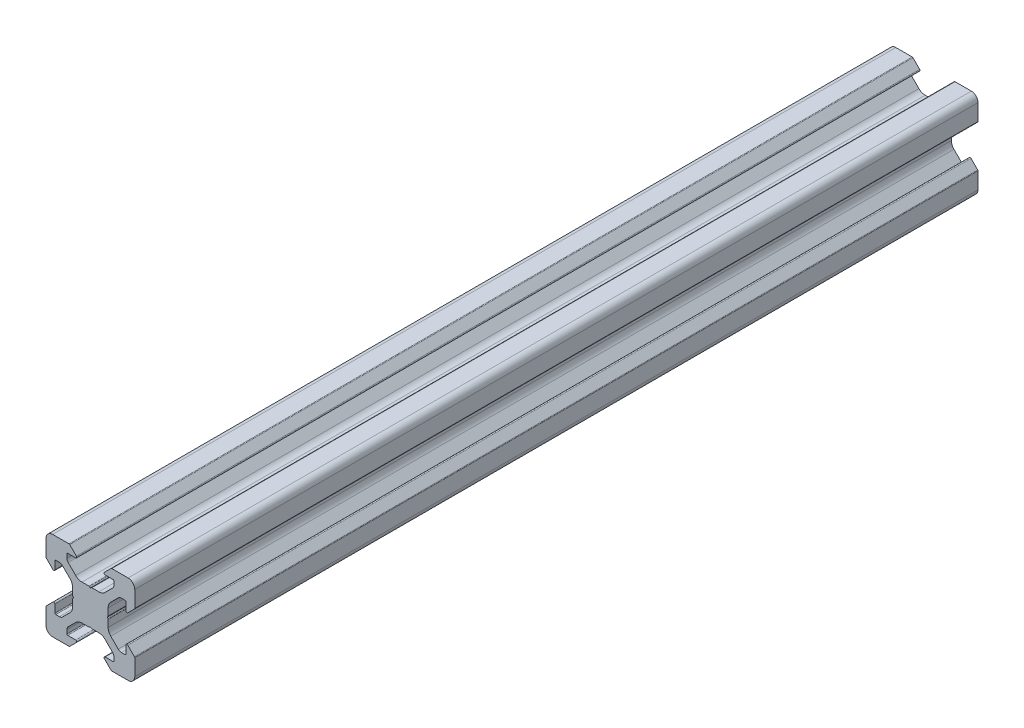
from build123d import *

# Parameters (mm, degrees)
EXTRUDE_1_DEPTH = 190


# Read off the part's stored shape, not the designer's step: 222 Конструкционный профиль 20х20-1-surface1
with BuildPart() as part:
    # Эскиз1 → Бобышка-Вытянуть1 (new body)
    with BuildSketch(Plane.XY):
        with BuildLine():
            Line((-3.945217202, 0.181521503), (-3.8, 0))
            Line((-3.8, 0), (-3.945217202, -0.181521503))
            ThreePointArc((-3.945217202, -0.181521503), (-3.98590708, -0.254943529), (-4, -0.337695265))
            Line((-4, -0.337695265), (-4, -1.898780669))
            ThreePointArc((-4, -1.898780669), (-4.152240935, -2.664147534), (-4.585786438, -3.312994231))
            Line((-4.585786438, -3.312994231), (-6.279898987, -5.007106781))
            ThreePointArc((-6.279898987, -5.007106781), (-6.604322336, -5.223879533), (-6.987005769, -5.3))
            Line((-6.987005769, -5.3), (-7.8, -5.3))
            ThreePointArc((-7.8, -5.3), (-7.941421356, -5.241421356), (-8, -5.1))
            Line((-8, -5.1), (-8, -3.33))
            ThreePointArc((-8, -3.33), (-8.154329142, -3.099030117), (-8.426776695, -3.153223305))
            Line((-8.426776695, -3.153223305), (-9.926776695, -4.653223305))
            ThreePointArc((-9.926776695, -4.653223305), (-9.980969883, -4.734329142), (-10, -4.83))
            Line((-10, -4.83), (-10, -8.5))
            ThreePointArc((-10, -8.5), (-9.560660172, -9.560660172), (-8.5, -10))
            Line((-8.5, -10), (-4.83, -10))
            ThreePointArc((-4.83, -10), (-4.734329142, -9.980969883), (-4.653223305, -9.926776695))
            Line((-4.653223305, -9.926776695), (-3.153223305, -8.426776695))
            ThreePointArc((-3.153223305, -8.426776695), (-3.099030117, -8.154329142), (-3.33, -8))
            Line((-3.33, -8), (-5.1, -8))
            ThreePointArc((-5.1, -8), (-5.241421356, -7.941421356), (-5.3, -7.8))
            Line((-5.3, -7.8), (-5.3, -6.987005769))
            ThreePointArc((-5.3, -6.987005769), (-5.223879533, -6.604322336), (-5.007106781, -6.279898987))
            Line((-5.007106781, -6.279898987), (-3.312994231, -4.585786438))
            ThreePointArc((-3.312994231, -4.585786438), (-2.664147534, -4.152240935), (-1.898780669, -4))
            Line((-1.898780669, -4), (-0.337695265, -4))
            ThreePointArc((-0.337695265, -4), (-0.254943529, -3.98590708), (-0.181521503, -3.945217202))
            Line((-0.181521503, -3.945217202), (0, -3.8))
            Line((0, -3.8), (0.181521503, -3.945217202))
            ThreePointArc((0.181521503, -3.945217202), (0.254943529, -3.98590708), (0.337695265, -4))
            Line((0.337695265, -4), (1.898780669, -4))
            ThreePointArc((1.898780669, -4), (2.664147534, -4.152240935), (3.312994231, -4.585786438))
            Line((3.312994231, -4.585786438), (5.007106781, -6.279898987))
            ThreePointArc((5.007106781, -6.279898987), (5.223879533, -6.604322336), (5.3, -6.987005769))
            Line((5.3, -6.987005769), (5.3, -7.8))
            ThreePointArc((5.3, -7.8), (5.241421356, -7.941421356), (5.1, -8))
            Line((5.1, -8), (3.33, -8))
            ThreePointArc((3.33, -8), (3.099030117, -8.154329142), (3.153223305, -8.426776695))
            Line((3.153223305, -8.426776695), (4.653223305, -9.926776695))
            ThreePointArc((4.653223305, -9.926776695), (4.734329142, -9.980969883), (4.83, -10))
            Line((4.83, -10), (8.5, -10))
            ThreePointArc((8.5, -10), (9.560660172, -9.560660172), (10, -8.5))
            Line((10, -8.5), (10, -4.83))
            ThreePointArc((10, -4.83), (9.980969883, -4.734329142), (9.926776695, -4.653223305))
            Line((9.926776695, -4.653223305), (8.426776695, -3.153223305))
            ThreePointArc((8.426776695, -3.153223305), (8.154329142, -3.099030117), (8, -3.33))
            Line((8, -3.33), (8, -5.1))
            ThreePointArc((8, -5.1), (7.941421356, -5.241421356), (7.8, -5.3))
            Line((7.8, -5.3), (6.987005769, -5.3))
            ThreePointArc((6.987005769, -5.3), (6.604322336, -5.223879533), (6.279898987, -5.007106781))
            Line((6.279898987, -5.007106781), (4.585786438, -3.312994231))
            ThreePointArc((4.585786438, -3.312994231), (4.152240935, -2.664147534), (4, -1.898780669))
            Line((4, -1.898780669), (4, -0.337695265))
            ThreePointArc((4, -0.337695265), (3.98590708, -0.254943529), (3.945217202, -0.181521503))
            Line((3.945217202, -0.181521503), (3.8, 0))
            Line((3.8, 0), (3.945217202, 0.181521503))
            ThreePointArc((3.945217202, 0.181521503), (3.98590708, 0.254943529), (4, 0.337695265))
            Line((4, 0.337695265), (4, 1.898780669))
            ThreePointArc((4, 1.898780669), (4.152240935, 2.664147534), (4.585786438, 3.312994231))
            Line((4.585786438, 3.312994231), (6.279898987, 5.007106781))
            ThreePointArc((6.279898987, 5.007106781), (6.604322336, 5.223879533), (6.987005769, 5.3))
            Line((6.987005769, 5.3), (7.8, 5.3))
            ThreePointArc((7.8, 5.3), (7.941421356, 5.241421356), (8, 5.1))
            Line((8, 5.1), (8, 3.33))
            ThreePointArc((8, 3.33), (8.154329142, 3.099030117), (8.426776695, 3.153223305))
            Line((8.426776695, 3.153223305), (9.926776695, 4.653223305))
            ThreePointArc((9.926776695, 4.653223305), (9.980969883, 4.734329142), (10, 4.83))
            Line((10, 4.83), (10, 8.5))
            ThreePointArc((10, 8.5), (9.560660172, 9.560660172), (8.5, 10))
            Line((8.5, 10), (4.83, 10))
            ThreePointArc((4.83, 10), (4.734329142, 9.980969883), (4.653223305, 9.926776695))
            Line((4.653223305, 9.926776695), (3.153223305, 8.426776695))
            ThreePointArc((3.153223305, 8.426776695), (3.099030117, 8.154329142), (3.33, 8))
            Line((3.33, 8), (5.1, 8))
            ThreePointArc((5.1, 8), (5.241421356, 7.941421356), (5.3, 7.8))
            Line((5.3, 7.8), (5.3, 6.987005769))
            ThreePointArc((5.3, 6.987005769), (5.223879533, 6.604322336), (5.007106781, 6.279898987))
            Line((5.007106781, 6.279898987), (3.312994231, 4.585786438))
            ThreePointArc((3.312994231, 4.585786438), (2.664147534, 4.152240935), (1.898780669, 4))
            Line((1.898780669, 4), (0.337695265, 4))
            ThreePointArc((0.337695265, 4), (0.254943529, 3.98590708), (0.181521503, 3.945217202))
            Line((0.181521503, 3.945217202), (0, 3.8))
            Line((0, 3.8), (-0.181521503, 3.945217202))
            ThreePointArc((-0.181521503, 3.945217202), (-0.254943529, 3.98590708), (-0.337695265, 4))
            Line((-0.337695265, 4), (-1.898780669, 4))
            ThreePointArc((-1.898780669, 4), (-2.664147534, 4.152240935), (-3.312994231, 4.585786438))
            Line((-3.312994231, 4.585786438), (-5.007106781, 6.279898987))
            ThreePointArc((-5.007106781, 6.279898987), (-5.223879533, 6.604322336), (-5.3, 6.987005769))
            Line((-5.3, 6.987005769), (-5.3, 7.8))
            ThreePointArc((-5.3, 7.8), (-5.241421356, 7.941421356), (-5.1, 8))
            Line((-5.1, 8), (-3.33, 8))
            ThreePointArc((-3.33, 8), (-3.099030117, 8.154329142), (-3.153223305, 8.426776695))
            Line((-3.153223305, 8.426776695), (-4.653223305, 9.926776695))
            ThreePointArc((-4.653223305, 9.926776695), (-4.734329142, 9.980969883), (-4.83, 10))
            Line((-4.83, 10), (-8.5, 10))
            ThreePointArc((-8.5, 10), (-9.560660172, 9.560660172), (-10, 8.5))
            Line((-10, 8.5), (-10, 4.83))
            ThreePointArc((-10, 4.83), (-9.980969883, 4.734329142), (-9.926776695, 4.653223305))
            Line((-9.926776695, 4.653223305), (-8.426776695, 3.153223305))
            ThreePointArc((-8.426776695, 3.153223305), (-8.154329142, 3.099030117), (-8, 3.33))
            Line((-8, 3.33), (-8, 5.1))
            ThreePointArc((-8, 5.1), (-7.941421356, 5.241421356), (-7.8, 5.3))
            Line((-7.8, 5.3), (-6.987005769, 5.3))
            ThreePointArc((-6.987005769, 5.3), (-6.604322336, 5.223879533), (-6.279898987, 5.007106781))
            Line((-6.279898987, 5.007106781), (-4.585786438, 3.312994231))
            ThreePointArc((-4.585786438, 3.312994231), (-4.152240935, 2.664147534), (-4, 1.898780669))
            Line((-4, 1.898780669), (-4, 0.337695265))
            ThreePointArc((-4, 0.337695265), (-3.98590708, 0.254943529), (-3.945217202, 0.181521503))
        make_face()
    extrude(amount=EXTRUDE_1_DEPTH)


solid = part.part
